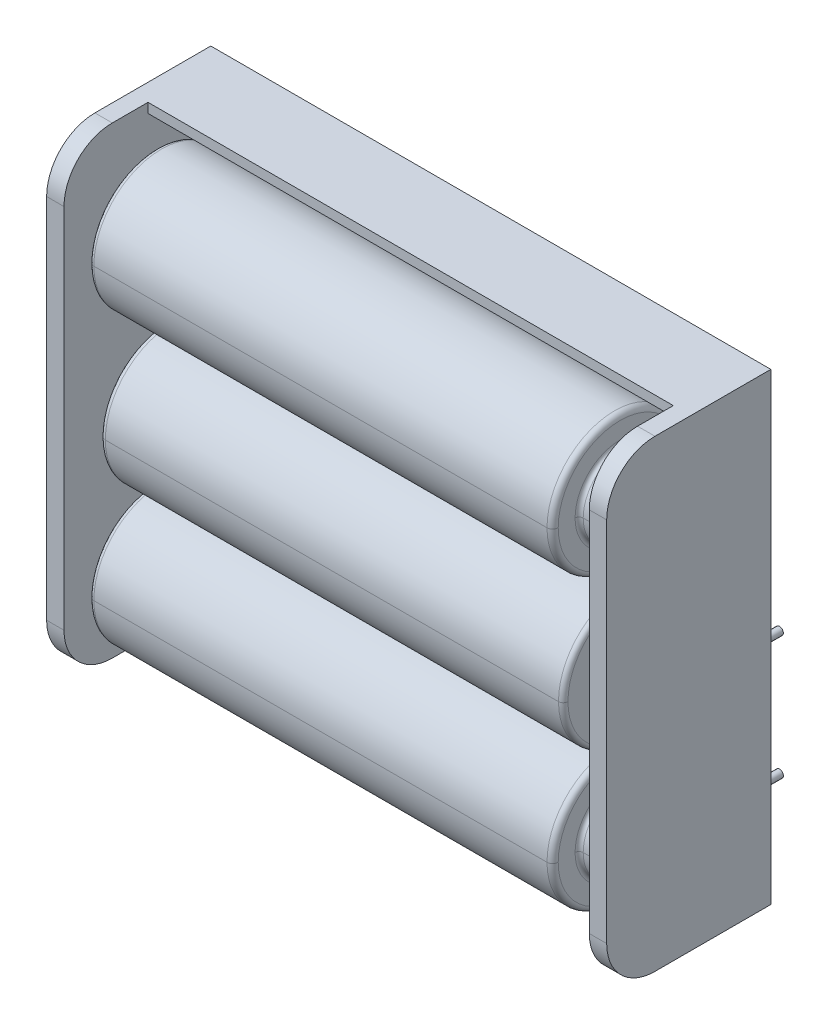
from build123d import *

# Parameters (mm, degrees)
SKETCH1_W                = 54.4
SKETCH1_H                = 1
SKETCH1_H_2              = 14.733333333
SKETCH1_R                = 1.75
SKETCH1_R_2              = 1.55
SKETCH1_R_3              = 0.4
SKETCH1_H_3              = 14.533333334
FLOOR_2_DEPTH            = 2.8
SIDES_START              = 2.8
SKETCH1_3_W              = 54.4
SKETCH1_3_H              = 1
SIDES_DEPTH              = 5.5
ENDS_START               = 8.3
ENDS_DEPTH               = 8.7
ROUND_ENDS_R             = 5
CHAMFER_SCREW_HOLES_SIZE = 1
PINS_START               = 2.8
SKETCH1_6_R              = 0.4
PINS_DEPTH               = 6
PINS_2_DEPTH             = 6
ROTATE_TOP_CELL_ANGLE    = 180


# Read off the part's stored shape, not the designer's step: place_mid_cell, place_top_cell
with BuildPart() as part:
    # Sketch1 → floor 2 (new body)
    # profile 1 of 9: a face of its own
    with BuildSketch(Plane.XY):
        Polygon((-27.2, 24), (-29, 24), (-29, -24), (-27.2, -24), (-27.2, -23), (-27.2, -8.266666667), (-27.2, -7.266666667), (-27.2, 7.266666667), (-27.2, 8.266666667), (-27.2, 23), align=None)
    # profile 2 of 9: a face of its own
    with BuildSketch(Plane.XY):
        with Locations((0, 23.5)):
            Rectangle(SKETCH1_W, SKETCH1_H)
    # profile 3 of 9: a face of its own
    with BuildSketch(Plane.XY):
        with Locations((0, -23.5)):
            Rectangle(SKETCH1_W, SKETCH1_H)
    # profile 4 of 9: a face of its own
    with BuildSketch(Plane.XY):
        with Locations((0, 15.633333334)):
            Rectangle(SKETCH1_W, SKETCH1_H_2)
        with Locations((0, 15)):
            Circle(SKETCH1_R, mode=Mode.SUBTRACT)
    # profile 5 of 9: a face of its own
    with BuildSketch(Plane.XY):
        Polygon((29, 24), (27.2, 24), (27.2, 23), (27.2, 8.266666667), (27.2, 7.266666667), (27.2, -7.266666667), (27.2, -8.266666667), (27.2, -23), (27.2, -24), (29, -24), align=None)
    # profile 6 of 9: a face of its own
    with BuildSketch(Plane.XY):
        with Locations((0, -15.633333334)):
            Rectangle(SKETCH1_W, SKETCH1_H_2)
        with Locations((0, -15)):
            Circle(SKETCH1_R_2, mode=Mode.SUBTRACT)
        with Locations((26.7, -15)):
            Circle(SKETCH1_R_3, mode=Mode.SUBTRACT)
    # profile 7 of 9: a face of its own
    with BuildSketch(Plane.XY):
        with Locations((0, 7.766666667)):
            Rectangle(SKETCH1_W, SKETCH1_H)
    # profile 8 of 9: a face of its own
    with BuildSketch(Plane.XY):
        with Locations((0, -7.766666667)):
            Rectangle(SKETCH1_W, SKETCH1_H)
    # profile 9 of 9: a face of its own
    with BuildSketch(Plane.XY):
        Rectangle(SKETCH1_W, SKETCH1_H_3)
        with Locations((26.7, -2.2)):
            Circle(SKETCH1_R_3, mode=Mode.SUBTRACT)
    extrude(amount=FLOOR_2_DEPTH)

    # Sketch1<3> → sides (add)
    with BuildSketch(Plane.XY.offset(SIDES_START)):
        with Locations((0, 23.5)):
            Rectangle(SKETCH1_3_W, SKETCH1_3_H)
        Polygon((27.2, -23), (27.2, -24), (29, -24), (29, 24), (27.2, 24), (27.2, 23), align=None)
        with Locations((0, -23.5)):
            Rectangle(SKETCH1_3_W, SKETCH1_3_H)
        Polygon((-29, 24), (-29, -24), (-27.2, -24), (-27.2, -23), (-27.2, 23), (-27.2, 24), align=None)
    extrude(amount=SIDES_DEPTH)

    # Sketch1<5> → ends (add)
    with BuildSketch(Plane.XY.offset(ENDS_START)):
        Polygon((27.2, -23), (27.2, -24), (29, -24), (29, 24), (27.2, 24), (27.2, 23), align=None)
        Polygon((-29, 24), (-29, -24), (-27.2, -24), (-27.2, -23), (-27.2, 23), (-27.2, 24), align=None)
    extrude(amount=ENDS_DEPTH)

    # round_ends
    round_ends_edges = [part.edges().sort_by_distance(p)[0] for p in [
        (28.1, -24, 17),
        (28.1, 24, 17),
        (-28.1, -24, 17),
        (-28.1, 24, 17),
    ]]
    fillet(round_ends_edges, radius=ROUND_ENDS_R)

    # chamfer_screw_holes
    chamfer_screw_holes_edges = [part.edges().sort_by_distance(p)[0] for p in [
        (-1.75, 15, 2.8),
        (-1.55, -15, 2.8),
    ]]
    chamfer(chamfer_screw_holes_edges, length=CHAMFER_SCREW_HOLES_SIZE)

    # place_mid_cell outline → place_mid_cell (revolve)
    with BuildSketch(Plane.YX.offset(-9.8)):
        with BuildLine():
            ThreePointArc((3.85, -25.2), (4.132842712, -25.082842712), (4.25, -24.8))
            Line((4.25, -24.8), (4.25, -24.12))
            ThreePointArc((4.25, -24.12), (4.373015152, -23.823015152), (4.67, -23.7))
            Line((4.67, -23.7), (6.42, -23.7))
            ThreePointArc((6.42, -23.7), (6.830121933, -23.530121933), (7, -23.12))
            Line((7, -23.12), (7, 23.81))
            ThreePointArc((7, 23.81), (6.856482323, 24.156482323), (6.51, 24.3))
            Line((6.51, 24.3), (0, 24.3))
            Line((0, 24.3), (0, -25.2))
            Line((0, -25.2), (3.85, -25.2))
        make_face()
    revolve(axis=Axis((0, 0, 9.8), (1, 0, 0)))


with BuildPart() as body_2:
    # Sketch1<6> → pins (new body)
    with BuildSketch(Plane.XY.offset(PINS_START)):
        with Locations((26.7, -15)):
            Circle(SKETCH1_6_R)
    extrude(amount=-PINS_DEPTH)


with BuildPart() as body_3:
    # Sketch1<6> → pins 2 (new body)
    with BuildSketch(Plane.XY.offset(PINS_START)):
        with Locations((26.7, -2.2)):
            Circle(SKETCH1_6_R)
    extrude(amount=-PINS_2_DEPTH)


with BuildPart() as body_4:
    # place_top_cell outline → place_top_cell (revolve)
    with BuildSketch(Plane(origin=(0, 15, 9.8), x_dir=(0, 1, 0), z_dir=(0, 0, -1))):
        with BuildLine():
            Line((6.51, 24.3), (0, 24.3))
            Line((0, 24.3), (0, -25.2))
            Line((0, -25.2), (3.85, -25.2))
            ThreePointArc((3.85, -25.2), (4.132842712, -25.082842712), (4.25, -24.8))
            Line((4.25, -24.8), (4.25, -24.12))
            ThreePointArc((4.25, -24.12), (4.373015152, -23.823015152), (4.67, -23.7))
            Line((4.67, -23.7), (6.42, -23.7))
            ThreePointArc((6.42, -23.7), (6.830121933, -23.530121933), (7, -23.12))
            Line((7, -23.12), (7, 23.81))
            ThreePointArc((7, 23.81), (6.856482323, 24.156482323), (6.51, 24.3))
        make_face()
    revolve(axis=Axis((0, 15, 9.8), (1, 0, 0)))


with BuildPart() as body_4_1:
    # rotate_top_cell: moved
    add(body_4.part.rotate(Axis((-0.25, 15, 0), (0, 0, 1)), ROTATE_TOP_CELL_ANGLE))


with BuildPart() as body_5:
    # place_bottom_cell: copy of body 4
    add(body_4_1.part.moved(Location((0, -30, 0))))


solid = Compound([part.part, body_2.part, body_3.part, body_4_1.part, body_5.part])
